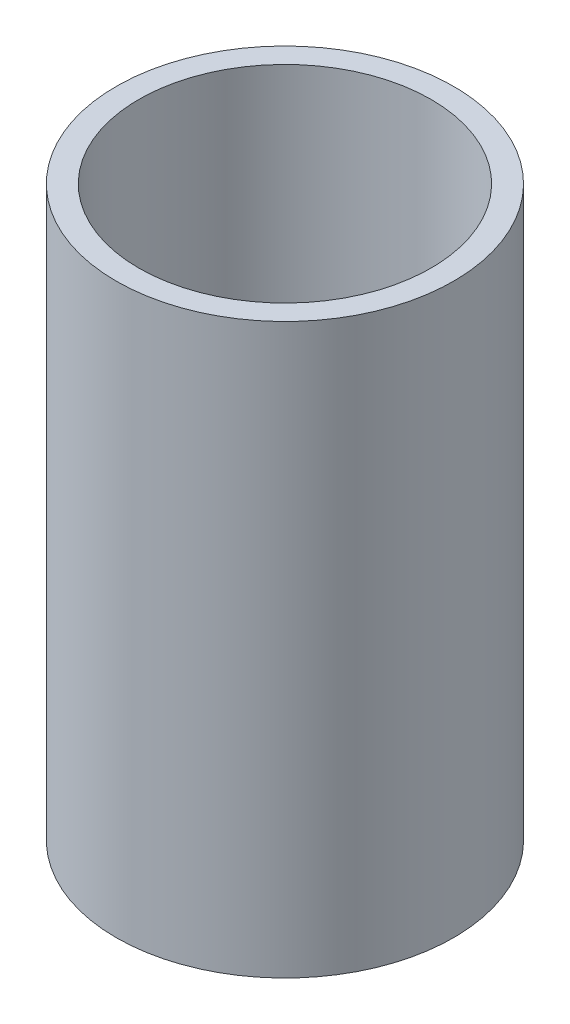
from build123d import *

# Parameters (mm, degrees)
SKETCH1_R           = 37.5
BOSS_EXTRUDE1_DEPTH = 126.378420376
SKETCH2_R           = 32.482020694
CUT_EXTRUDE1_DEPTH  = 138.054752332


with BuildPart() as part:
    # Sketch1 → Boss-Extrude1 (new body)
    with BuildSketch(Plane(origin=(0, 0, 0), x_dir=(1, 0, 0), z_dir=(0, 1, 0))):
        Circle(SKETCH1_R)
    extrude(amount=BOSS_EXTRUDE1_DEPTH)

    # Sketch2 → Cut-Extrude1 (cut, through all)
    with BuildSketch(Plane(origin=(0, 0, 0), x_dir=(1, 0, 0), z_dir=(0, 1, 0))):
        Circle(SKETCH2_R)
    extrude(amount=CUT_EXTRUDE1_DEPTH, mode=Mode.SUBTRACT)


solid = part.part
